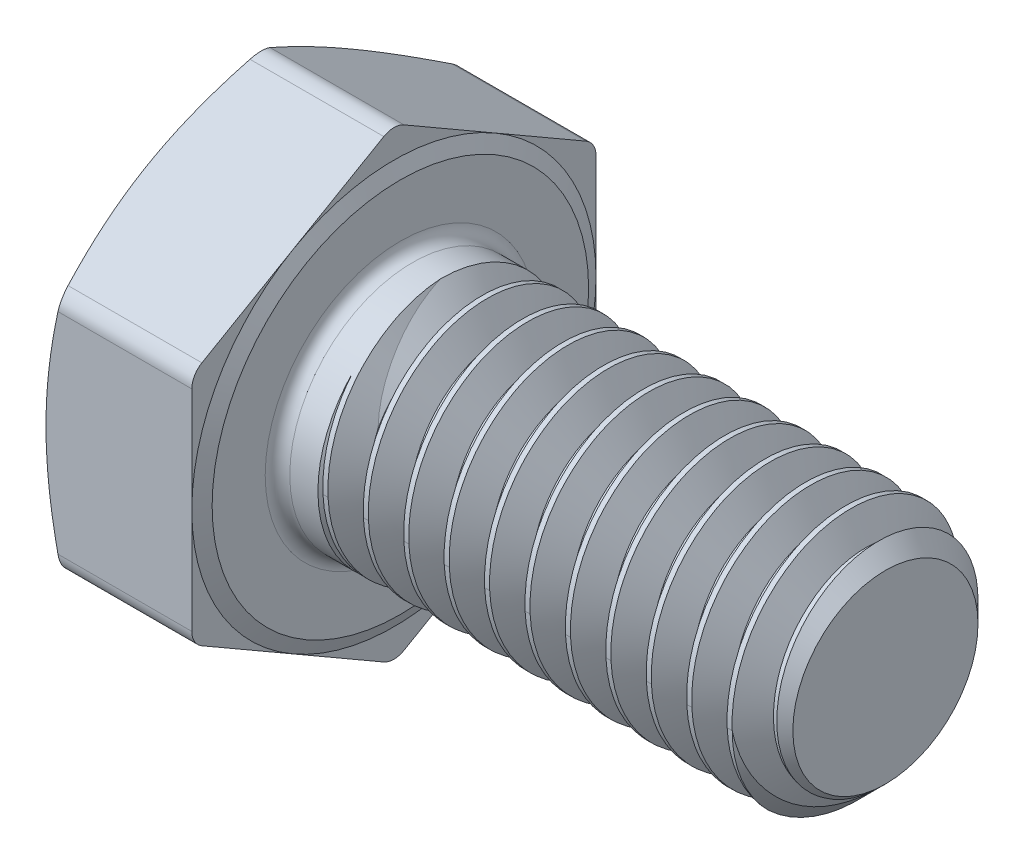
from build123d import *

# Parameters (mm, degrees)
SKETCH2_R                = 2.413
BOSS_EXTRUDE1_DEPTH      = 9.525
BOSS_EXTRUDE2_DEPTH      = 3.175
SKETCH5_OUTSIDE_W        = 27.068
SKETCH5_OUTSIDE_H        = 28.296
SKETCH5_OUTSIDE_R        = 3.571875
CUT_EXTRUDE1_DEPTH       = 3.175
CUT_EXTRUDE1_DRAFT       = -65
BOSS_EXTRUDE5_DEPTH      = 0.0635
FILLET5_R                = 0.0635
CIRPATTERN1_COUNT        = 6
FILLET5_OF_CIRPATTERN1_R = 0.0635
FILLET7_R                = 0.396875
CHAMFER1_SIZE            = 0.5953125
FILLET4_R                = 0.2413
CUT_SWEEP1_PITCH         = 0.79375
CUT_SWEEP1_TO            = 8.73125


with BuildPart() as part:
    # Sketch2 → Boss-Extrude1 (new body)
    with BuildSketch(Plane(origin=(0, 0, 0), x_dir=(0, 0, -1), z_dir=(1, 0, 0))):
        with Locations(Location((0, 0, 0), (0, 0, 180))):
            Circle(SKETCH2_R)
    extrude(amount=BOSS_EXTRUDE1_DEPTH)

    # Sketch3 → Boss-Extrude2 (add)
    with BuildSketch(Plane.ZY):
        Polygon((0, 4.582717762), (-3.96875, 2.291358881), (-3.96875, -2.291358881), (0, -4.582717762), (3.96875, -2.291358881), (3.96875, 2.291358881), align=None)
    extrude(amount=BOSS_EXTRUDE2_DEPTH)


with BuildPart() as cut_extrude1_tool:
    # Sketch5 outside → Cut-Extrude1 (with draft: the straight prism first)
    with BuildSketch(Plane.ZY.offset(3.175)):
        Rectangle(SKETCH5_OUTSIDE_W, SKETCH5_OUTSIDE_H)
        Circle(SKETCH5_OUTSIDE_R, mode=Mode.SUBTRACT)
    extrude(amount=-CUT_EXTRUDE1_DEPTH)
    # Cut-Extrude1: the draft: its side faces are tilted about the plane it starts from
    cut_extrude1_sides = [cut_extrude1_tool.faces().sort_by_distance(p)[0] for p in [
        (-1.5875, -14.148, 0),
        (-1.5875, 0, 13.534),
        (-1.5875, 14.148, 0),
        (-1.5875, 0, -13.534),
        (-1.5875, 0, -3.571875),
    ]]
    draft(cut_extrude1_sides, Plane.ZY.offset(3.175), CUT_EXTRUDE1_DRAFT)


with BuildPart() as part_1:
    add(part.part)

    # Cut-Extrude1: cut by cut_extrude1_tool
    add(cut_extrude1_tool.part, mode=Mode.SUBTRACT)

    # Sketch11 → Boss-Extrude5 (add)
    with BuildSketch(Plane.ZY.offset(3.175)):
        with BuildLine():
            Line((0.15875, 2.8178125), (0.15875, 1.74625))
            ThreePointArc((0.15875, 1.74625), (0, 1.5875), (-0.15875, 1.74625))
            Line((-0.15875, 1.74625), (-0.15875, 2.8178125))
            ThreePointArc((-0.15875, 2.8178125), (0, 2.9765625), (0.15875, 2.8178125))
        make_face()
    boss_extrude5 = extrude(amount=BOSS_EXTRUDE5_DEPTH)

    # Fillet5
    fillet5_edges = [part_1.edges().sort_by_distance(p)[0] for p in [
        (-3.2385, 2.28203125, 0.15875),
        (-3.2385, 1.5875, 0),
        (-3.2385, 2.28203125, -0.15875),
        (-3.2385, 2.9765625, 0),
    ]]
    fillet(fillet5_edges, radius=FILLET5_R - 0.0001)  # a hair under: the kernel refuses the full size

    # CirPattern1: Boss-Extrude5 ×6 about axis
    cirpattern1_axis = Axis((0, 0, 0), (1, 0, 0))
    for i in range(1, CIRPATTERN1_COUNT):
        add(boss_extrude5.rotate(cirpattern1_axis, i * 360 / CIRPATTERN1_COUNT))

    # Fillet5 of CirPattern1
    fillet5_of_cirpattern1_edges = [part_1.edges().sort_by_distance(p)[0] for p in [
        (-3.2385, 1.003534092, 2.055672035),
        (-3.2385, 0.79375, 1.374815329),
        (-3.2385, 1.278497158, 1.896922035),
        (-3.2385, 1.48828125, 2.577778741),
        (-3.2385, -1.278497158, 1.896922035),
        (-3.2385, -0.79375, 1.374815329),
        (-3.2385, -1.003534092, 2.055672035),
        (-3.2385, -1.48828125, 2.577778741),
        (-3.2385, -2.28203125, -0.15875),
        (-3.2385, -1.5875, 0),
        (-3.2385, -2.28203125, 0.15875),
        (-3.2385, -2.9765625, 0),
        (-3.2385, -1.003534092, -2.055672035),
        (-3.2385, -0.79375, -1.374815329),
        (-3.2385, -1.278497158, -1.896922035),
        (-3.2385, -1.48828125, -2.577778741),
        (-3.2385, 1.278497158, -1.896922035),
        (-3.2385, 0.79375, -1.374815329),
        (-3.2385, 1.003534092, -2.055672035),
        (-3.2385, 1.48828125, -2.577778741),
    ]]
    fillet(fillet5_of_cirpattern1_edges, radius=FILLET5_OF_CIRPATTERN1_R - 0.0001)  # a hair under: the kernel refuses the full size

    # Fillet7
    fillet7_edges = [part_1.edges().sort_by_distance(p)[0] for p in [
        (-1.35181814, -4.582717762, 0),
        (-1.35181814, -2.291358881, -3.96875),
        (-1.35181814, 2.291358881, -3.96875),
        (-1.35181814, 4.582717762, 0),
        (-1.35181814, -2.291358881, 3.96875),
        (-1.35181814, 2.291358881, 3.96875),
    ]]
    fillet(fillet7_edges, radius=FILLET7_R)

    # Chamfer1
    chamfer1_edges = [part_1.edges().sort_by_distance(p)[0] for p in [
        (9.525, 0, -2.413),
    ]]
    chamfer(chamfer1_edges, length=CHAMFER1_SIZE)

    # Sketch15 → Cut-Revolve1 (revolve, cut)
    with BuildSketch(Plane.XY, mode=Mode.PRIVATE) as cut_revolve1_sk:
        Polygon((0, 3.696397621), (-0.127, 3.96875), (-0.127, 4.582717762), (0, 4.582717762), align=None)
    revolve(cut_revolve1_sk.sketch.rotate(Axis((0, 0, 0), (-1, 0, 0)), 210), axis=Axis((0, 0, 0), (-1, 0, 0)), mode=Mode.SUBTRACT)

    # Fillet4
    fillet4_edges = [part_1.edges().sort_by_distance(p)[0] for p in [
        (0, 0, -2.413),
    ]]
    fillet(fillet4_edges, radius=FILLET4_R)


with BuildPart() as body_2:
    # Split1: the piece on the far side of the plane
    add(part_1.part)
    split(bisect_by=Plane(origin=(0.79375, 0, 0), x_dir=(0, 0, 1), z_dir=(1, 0, 0)), keep=Keep.BOTTOM)


with BuildPart() as part_2:
    add(part_1.part)

    # Split1
    split(bisect_by=Plane(origin=(0.79375, 0, 0), x_dir=(0, 0, 1), z_dir=(1, 0, 0)), keep=Keep.TOP)

    # Cut-Sweep1: arcs per turn and ends read off the stored shape
    # Cut-Sweep1: the profile of Sketch13 profile screwed along a right-hand helix through 13 turns, 8 arcs to a turn; built about Z, then put on its axis
    cut_sweep1_z = Axis((0, 0, 0), (0, 0, 1))
    cut_sweep1_corners = [(2.4133, 0, 0.000173205), (2.4133, 0, -0.694704455), (1.897444252, 0, -0.396875), (1.897444252, 0, -0.29765625)]
    with BuildLine(mode=Mode.PRIVATE) as cut_sweep1_profile:
        Line(cut_sweep1_corners[0], cut_sweep1_corners[1])
        Line(cut_sweep1_corners[1], cut_sweep1_corners[2])
        Line(cut_sweep1_corners[2], cut_sweep1_corners[3])
        Line(cut_sweep1_corners[3], cut_sweep1_corners[0])
    cut_sweep1_cap = Face(cut_sweep1_profile.wire())
    cut_sweep1_turn_angles = [0, 22.5, 45, 67.5, 90, 112.5, 135, 157.5, 180, 202.5, 225, 247.5, 270, 292.5, 315, 337.5, 360]
    cut_sweep1_turn_weights = [1, 0.9238795325112867, 1, 0.9238795325112867, 1, 0.9238795325112867, 1, 0.9238795325112867, 1, 0.9238795325112867, 1, 0.9238795325112867, 1, 0.9238795325112867, 1, 0.9238795325112867, 1]
    cut_sweep1_turn_rails = [Edge.make_bspline([Vector(p[0], p[1], 0).rotate(cut_sweep1_z, cut_sweep1_turn_angles[k]) / cut_sweep1_turn_weights[k] + Vector(0, 0, p[2] + CUT_SWEEP1_PITCH * cut_sweep1_turn_angles[k] / 360) for k in range(17)], [0, 0, 0, 1, 1, 2, 2, 3, 3, 4, 4, 5, 5, 6, 6, 7, 7, 8, 8, 8], 2, cut_sweep1_turn_weights) for p in cut_sweep1_corners]
    cut_sweep1_turn_sides = [Face.make_surface_from_curves(cut_sweep1_turn_rails[p[0]], cut_sweep1_turn_rails[p[1]]) for p in [(0, 1), (1, 2), (2, 3), (3, 0)]]
    cut_sweep1 = Plane(origin=(9.525, 0, 0), x_dir=(0, 1, 0), z_dir=(-1, 0, 0)) * split(Solid(Shell([*[p.moved(Location((0, 0, CUT_SWEEP1_PITCH * i))) for i in range(13) for p in cut_sweep1_turn_sides], cut_sweep1_cap, cut_sweep1_cap.rotate(cut_sweep1_z, 4680).moved(Location((0, 0, CUT_SWEEP1_PITCH * 4680 / 360)))])), bisect_by=Plane.XY.offset(CUT_SWEEP1_TO), keep=Keep.BOTTOM, mode=Mode.PRIVATE)
    add(cut_sweep1, mode=Mode.SUBTRACT)


with BuildPart() as boss_extrude4_tool:
    # Boss-Extrude4: read off the stored shape, not the designer's step
    # Boss-Extrude4 outline → Boss-Extrude4 (revolve)
    with BuildSketch(Plane.YX):
        Polygon((2.413, 0.79375), (1.897437563, 1.226358251), (1.897437563, 0.79375), align=None)
    revolve(axis=Axis((0, 0, 0), (1, 0, 0)))


with BuildPart() as part_3:
    add(part_2.part)


with BuildPart() as part_4:
    # Boss-Extrude4: joined with boss_extrude4_tool
    add(part_3.part.fuse(boss_extrude4_tool.part, body_2.part, tol=0.00001))


solid = part_4.part
